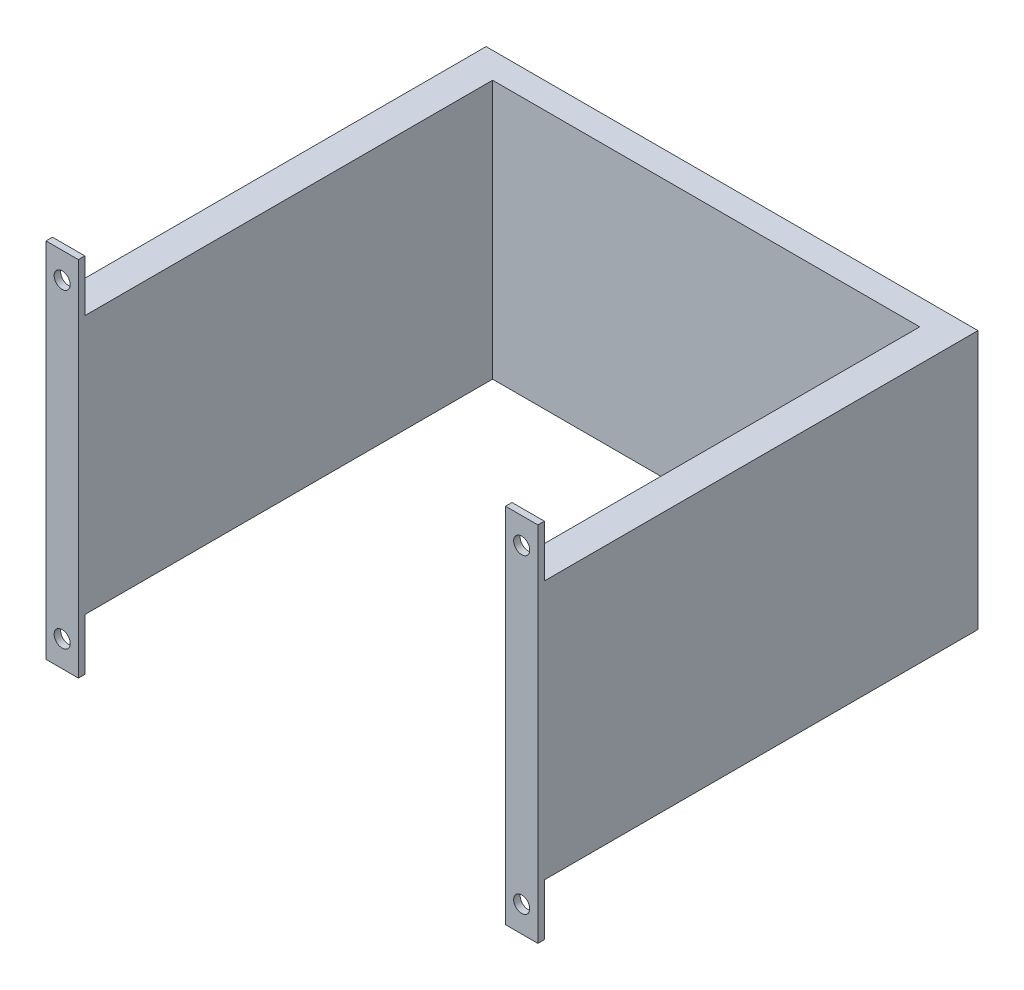
from build123d import *

# Parameters (mm, degrees)
SKETCH1_W           = 241.3
SKETCH1_H           = 127
BOSS_EXTRUDE1_DEPTH = 215.9
SKETCH5_W           = 209.55
SKETCH5_H           = 127
CUT_EXTRUDE1_DEPTH  = 203.2
SKETCH6_W           = 15.875
SKETCH6_H           = 25.4
BOSS_EXTRUDE2_DEPTH = 3.175
SKETCH7_R           = 3.937
CUT_EXTRUDE2_DEPTH  = 261.214446419


with BuildPart() as part:
    # Sketch1 → Boss-Extrude1 (new body)
    with BuildSketch(Plane.XY):
        Rectangle(SKETCH1_W, SKETCH1_H)
    extrude(amount=BOSS_EXTRUDE1_DEPTH)

    # Sketch5 → Cut-Extrude1 (cut)
    with BuildSketch(Plane.XY.offset(215.9)):
        Rectangle(SKETCH5_W, SKETCH5_H)
    extrude(amount=-CUT_EXTRUDE1_DEPTH, mode=Mode.SUBTRACT)

    # Sketch6 → Boss-Extrude2 (add)
    with BuildSketch(Plane.XY.offset(215.9)):
        with Locations((112.7125, 76.2)):
            Rectangle(SKETCH6_W, SKETCH6_H)
        with Locations((-112.7125, 76.2)):
            Rectangle(SKETCH6_W, SKETCH6_H)
        with Locations((112.7125, -76.2)):
            Rectangle(SKETCH6_W, SKETCH6_H)
        with Locations((-112.7125, -76.2)):
            Rectangle(SKETCH6_W, SKETCH6_H)
    extrude(amount=-BOSS_EXTRUDE2_DEPTH)

    # Sketch7 → Cut-Extrude2 (cut, through all)
    with BuildSketch(Plane(origin=(0, 0, 212.725), x_dir=(-1, 0, 0), z_dir=(0, 0, -1))):
        with Locations((112.7125, 76.2)):
            Circle(SKETCH7_R)
        with Locations((-112.7125, 76.2)):
            Circle(SKETCH7_R)
        with Locations((112.7125, -76.2)):
            Circle(SKETCH7_R)
        with Locations((-112.7125, -76.2)):
            Circle(SKETCH7_R)
    extrude(amount=-CUT_EXTRUDE2_DEPTH, mode=Mode.SUBTRACT)


solid = part.part
